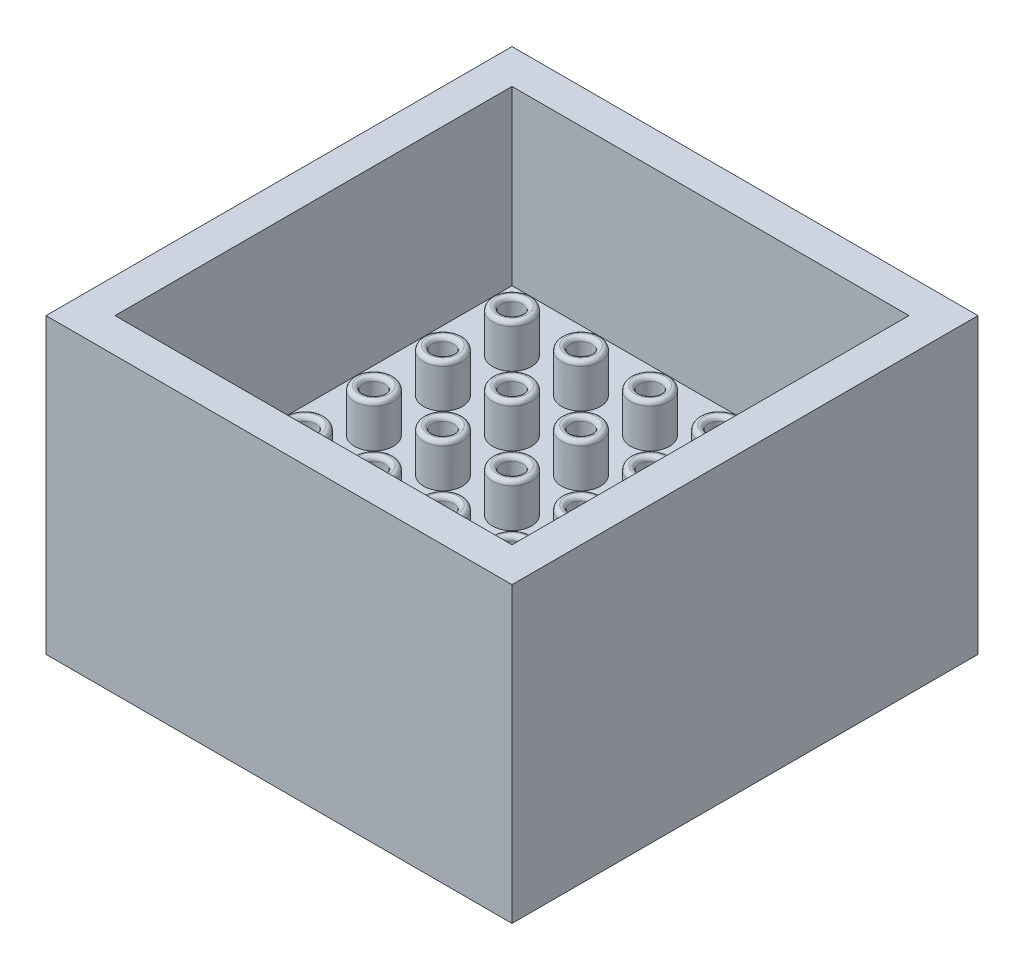
from build123d import *

# Parameters (mm, degrees)
SKETCH1_W              = 27
SKETCH1_H              = 27
SKETCH1_W_2            = 23
SKETCH1_H_2            = 23
BOSS_EXTRUDE1_DEPTH    = 10
SKETCH2_W              = 27
SKETCH2_H              = 27
BOSS_EXTRUDE2_DEPTH    = 2
SKETCH3_W              = 27
SKETCH3_H              = 27
SKETCH3_W_2            = 23
SKETCH3_H_2            = 23
BOSS_EXTRUDE3_DEPTH    = 5
SKETCH6_R              = 1.125
BOSS_EXTRUDE5_DEPTH    = 2.5
CUT_EXTRUDE2_REACH     = 23.325
SKETCH7_R              = 0.625
FILLET3_R              = 0.25
LPATTERN1_COUNT        = 5
LPATTERN1_PITCH        = 4
LPATTERN1_COUNT_DIR2   = 5
LPATTERN1_PITCH_DIR2   = 4
FILLET3_OF_LPATTERN1_R = 0.25


with BuildPart() as part:
    # Sketch1 → Boss-Extrude1 (new body)
    with BuildSketch(Plane(origin=(0, 0, 0), x_dir=(1, 0, 0), z_dir=(0, 1, 0))):
        Rectangle(SKETCH1_W, SKETCH1_H)
        Rectangle(SKETCH1_W_2, SKETCH1_H_2, mode=Mode.SUBTRACT)
    extrude(amount=BOSS_EXTRUDE1_DEPTH)

    # Sketch2 → Boss-Extrude2 (add)
    with BuildSketch(Plane.XZ):
        Rectangle(SKETCH2_W, SKETCH2_H)
    extrude(amount=BOSS_EXTRUDE2_DEPTH)

    # Sketch3 → Boss-Extrude3 (add)
    with BuildSketch(Plane.XZ.offset(2)):
        Rectangle(SKETCH3_W, SKETCH3_H)
        Rectangle(SKETCH3_W_2, SKETCH3_H_2, mode=Mode.SUBTRACT)
    extrude(amount=BOSS_EXTRUDE3_DEPTH)

    # Sketch6 → Boss-Extrude5 (add)
    with BuildSketch(Plane(origin=(0, 0, 0), x_dir=(1, 0, 0), z_dir=(0, 1, 0))):
        with Locations(Location((8, 8, 0), (0, 0, 90))):
            Circle(SKETCH6_R)
    boss_extrude5 = extrude(amount=BOSS_EXTRUDE5_DEPTH)

    # Sketch7 → Cut-Extrude2 (cut, up to next)
    with BuildSketch(Plane(origin=(0, 2.5, 0), x_dir=(1, 0, 0), z_dir=(0, 1, 0)), mode=Mode.PRIVATE) as cut_extrude2_sk1:
        with Locations(Location((8, 8, 0), (0, 0, 270))):
            Circle(SKETCH7_R)
    cut_extrude2_tool1 = extrude(cut_extrude2_sk1.sketch, amount=-CUT_EXTRUDE2_REACH, mode=Mode.PRIVATE) & part.part
    cut_extrude2 = cut_extrude2_tool1.solids().sort_by_distance((8, 2.5, -8))[0]
    add(cut_extrude2, mode=Mode.SUBTRACT)

    # Fillet3
    fillet3_edges = [part.edges().sort_by_distance(p)[0] for p in [
        (8, 2.5, -6.875),
        (8, 2.5, -8.625),
    ]]
    fillet(fillet3_edges, radius=FILLET3_R - 0.0001)  # a hair under: the kernel refuses the full size

    # LPattern1: Boss-Extrude5, Cut-Extrude2 5 × 5
    with Locations(*[(-j * LPATTERN1_PITCH_DIR2, 0, i * LPATTERN1_PITCH) for i in range(LPATTERN1_COUNT) for j in range(LPATTERN1_COUNT_DIR2) if (i, j) != (0, 0)]):
        add(boss_extrude5)
        add(cut_extrude2, mode=Mode.SUBTRACT)

    # Fillet3 of LPattern1
    fillet3_of_lpattern1_edges = [part.edges().sort_by_distance(p)[0] for p in [
        (4, 2.5, -6.875),
        (4, 2.5, -8.625),
        (0, 2.5, -6.875),
        (0, 2.5, -8.625),
        (-4, 2.5, -6.875),
        (-4, 2.5, -8.625),
        (-8, 2.5, -6.875),
        (-8, 2.5, -8.625),
        (8, 2.5, -2.875),
        (8, 2.5, -4.625),
        (4, 2.5, -2.875),
        (4, 2.5, -4.625),
        (0, 2.5, -2.875),
        (0, 2.5, -4.625),
        (-4, 2.5, -2.875),
        (-4, 2.5, -4.625),
        (-8, 2.5, -2.875),
        (-8, 2.5, -4.625),
        (8, 2.5, 1.125),
        (8, 2.5, -0.625),
        (4, 2.5, 1.125),
        (4, 2.5, -0.625),
        (0, 2.5, 1.125),
        (0, 2.5, -0.625),
        (-4, 2.5, 1.125),
        (-4, 2.5, -0.625),
        (-8, 2.5, 1.125),
        (-8, 2.5, -0.625),
        (8, 2.5, 5.125),
        (8, 2.5, 3.375),
        (4, 2.5, 5.125),
        (4, 2.5, 3.375),
        (0, 2.5, 5.125),
        (0, 2.5, 3.375),
        (-4, 2.5, 5.125),
        (-4, 2.5, 3.375),
        (-8, 2.5, 5.125),
        (-8, 2.5, 3.375),
        (8, 2.5, 9.125),
        (8, 2.5, 7.375),
        (4, 2.5, 9.125),
        (4, 2.5, 7.375),
        (0, 2.5, 9.125),
        (0, 2.5, 7.375),
        (-4, 2.5, 9.125),
        (-4, 2.5, 7.375),
        (-8, 2.5, 9.125),
        (-8, 2.5, 7.375),
    ]]
    fillet(fillet3_of_lpattern1_edges, radius=FILLET3_OF_LPATTERN1_R - 0.0001)  # a hair under: the kernel refuses the full size


solid = part.part
